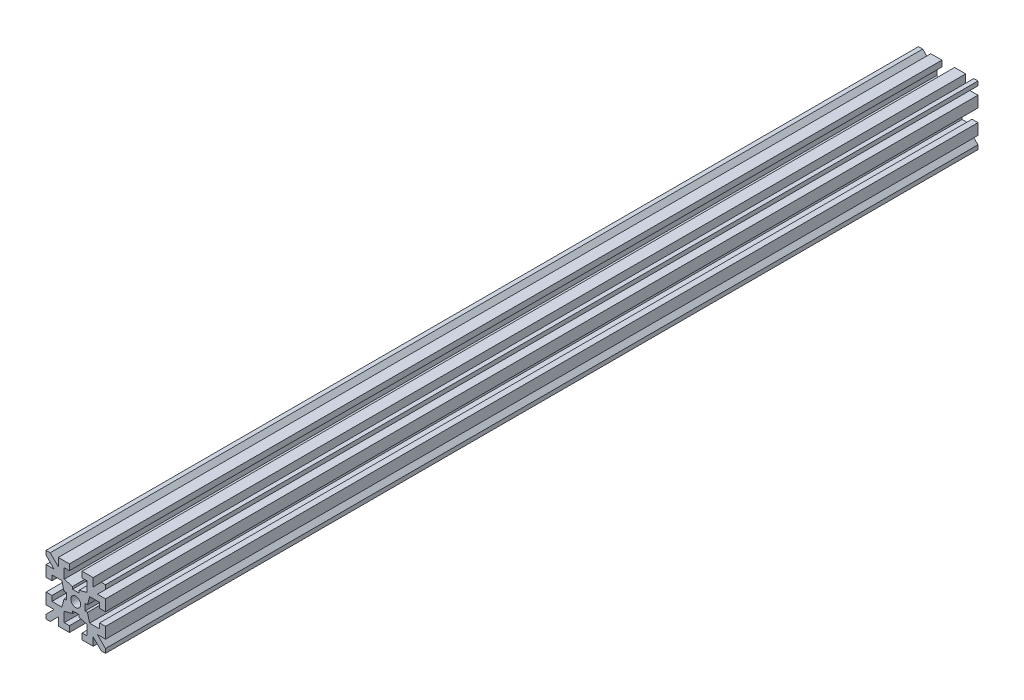
from build123d import *

# Parameters (mm, degrees)
RESSALTO_EXTRUS_O1_DEPTH   = 110
ESPELHAR2_COPY_1_DEPTH     = 110
ESPELHAR2_COPY_2_DEPTH     = 110
CORTE_EXTRUS_O1_DEPTH      = 221.255533415
CORTE_EXTRUS_O1_DEPTH_BACK = 221.255533415
ESBO_O2_R                  = 1.25


with BuildPart() as part:
    # Esboço1 → Ressalto-extrusão1 (new, symmetric)
    with BuildSketch(Plane.XY):
        Polygon((0, 2.35), (-0.825, 2.35), (-0.825, 2.95), (-2.9, 3.5), (-2.9, 6), (-1.6, 6), (-1.6, 7.5), (-4.4, 7.5), (-4.4, 5.460660172), (-6.439339828, 7.5), (-7.5, 7.5), (-7.5, 6.439339828), (-5.460660172, 4.4), (-7.5, 4.4), (-7.5, 1.6), (-6, 1.6), (-6, 2.9), (-3.5, 2.9), (-2.95, 0.825), (-2.35, 0.825), (-2.35, 0), (0, 0), align=None)
    ressalto_extrus_o1 = extrude(amount=RESSALTO_EXTRUS_O1_DEPTH, both=True)

    # Espelhar1: Ressalto-extrusão1 across plane
    add(ressalto_extrus_o1.mirror(Plane.ZX))

    # Espelhar2 copy 1 sketch → Espelhar2 copy 1 (add, symmetric)
    with BuildSketch(Plane(origin=(0, 0, 0), x_dir=(-1, 0, 0), z_dir=(0, 0, 1))):
        Polygon((0, 2.35), (-0.825, 2.35), (-0.825, 2.95), (-2.9, 3.5), (-2.9, 6), (-1.6, 6), (-1.6, 7.5), (-4.4, 7.5), (-4.4, 5.460660172), (-6.439339828, 7.5), (-7.5, 7.5), (-7.5, 6.439339828), (-5.460660172, 4.4), (-7.5, 4.4), (-7.5, 1.6), (-6, 1.6), (-6, 2.9), (-3.5, 2.9), (-2.95, 0.825), (-2.35, 0.825), (-2.35, 0), (0, 0), align=None)
    extrude(amount=ESPELHAR2_COPY_1_DEPTH, both=True)

    # Espelhar2 copy 2 sketch → Espelhar2 copy 2 (add, symmetric)
    with BuildSketch(Plane(origin=(0, 0, 0), x_dir=(-1, 0, 0), z_dir=(0, 0, 1))):
        Polygon((0, -2.35), (-0.825, -2.35), (-0.825, -2.95), (-2.9, -3.5), (-2.9, -6), (-1.6, -6), (-1.6, -7.5), (-4.4, -7.5), (-4.4, -5.460660172), (-6.439339828, -7.5), (-7.5, -7.5), (-7.5, -6.439339828), (-5.460660172, -4.4), (-7.5, -4.4), (-7.5, -1.6), (-6, -1.6), (-6, -2.9), (-3.5, -2.9), (-2.95, -0.825), (-2.35, -0.825), (-2.35, 0), (0, 0), align=None)
    extrude(amount=ESPELHAR2_COPY_2_DEPTH, both=True)

    # Esboço2 → Corte-extrusão1 (cut, two sides: drawn at the far end of the back side and taken through both)
    with BuildSketch(Plane.XY.offset(110).offset(-CORTE_EXTRUS_O1_DEPTH_BACK)):
        Circle(ESBO_O2_R)
    extrude(amount=CORTE_EXTRUS_O1_DEPTH + CORTE_EXTRUS_O1_DEPTH_BACK, mode=Mode.SUBTRACT)


solid = part.part
